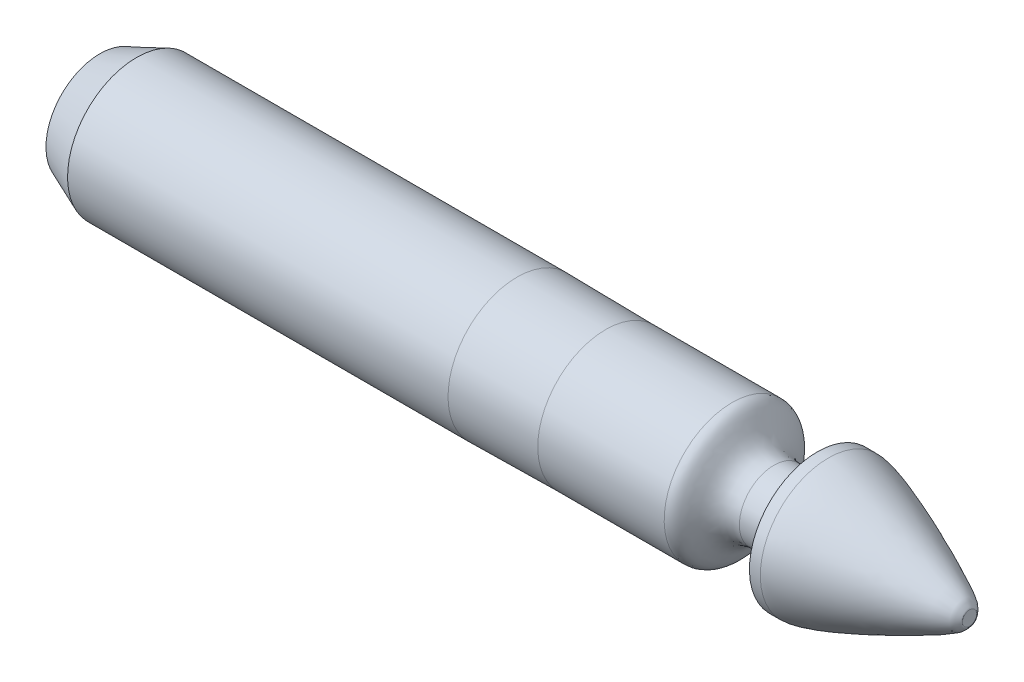
from build123d import *


with BuildPart() as part:
    # body_sketch → body (revolve)
    with BuildSketch(Plane.XY):
        with BuildLine():
            Line((-16.73571407, 3.1242), (-10.921788615, 3.1242))
            add(Edge.make_bspline(
                [(-10.921788615, 3.1242), (-10.165447426, 3.1242), (-10.250040485, 1.5875), (-9, 1.5875)],
                knots=[0, 0, 0, 0, 1, 1, 1, 1], degree=3))
            Line((-9, 1.5875), (-7, 1.5875))
            Line((-7, 1.5875), (-7, 3.1242))
            Line((-7, 3.1242), (-6.5, 3.1242))
            add(Edge.make_bspline(
                [(-6.5, 3.1242), (-5.484084378, 3.1242), (-0.454332814, 0.897574339), (-0.05462572, 0.423798373), (0, 0.377250903), (0, 0.327812847)],
                knots=[0, 0, 0, 0, 0.586137631, 0.686137631, 1, 1, 1, 1], degree=3))
            Line((0, 0.327812847), (0, 0))
            Line((0, 0), (-40, 0))
            Line((-40, 0), (-40, 2.477839401))
            Line((-40, 2.477839401), (-38.309951565, 3.175))
            Line((-38.309951565, 3.175), (-20.811079947, 3.175))
            add(Edge.make_bspline(
                [(-20.811079947, 3.175), (-19.383200887, 3.175), (-18.073641119, 3.1242), (-16.73571407, 3.1242)],
                knots=[0, 0, 0, 0, 1, 1, 1, 1], degree=3))
        make_face()
    revolve(axis=Axis((0, 0, 0), (-1, 0, 0)))


solid = part.part
